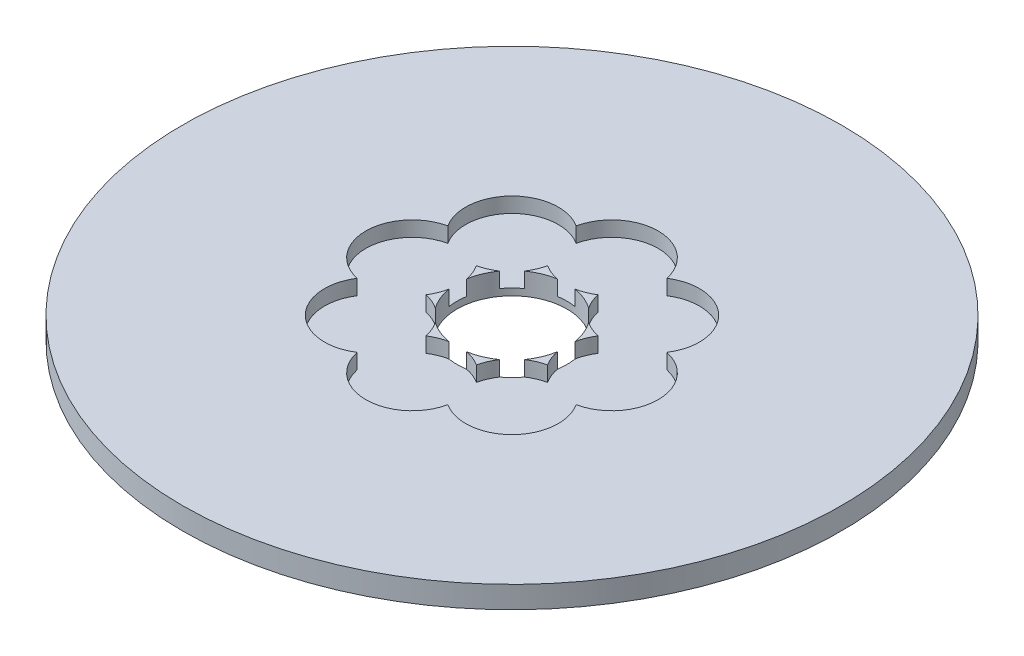
from build123d import *

# Parameters (mm, degrees)
SKETCH1_R           = 60
BOSS_EXTRUDE1_DEPTH = 4
SKETCH2_R           = 10
CUT_EXTRUDE1_DEPTH  = 85.947042326
SKETCH3_R           = 8.446784488
CUT_EXTRUDE2_DEPTH  = 2.755912844
CIRPATTERN1_COUNT   = 8


with BuildPart() as part:
    # Sketch1 → Boss-Extrude1 (new body)
    with BuildSketch(Plane(origin=(0, 0, 0), x_dir=(1, 0, 0), z_dir=(0, 1, 0))):
        Circle(SKETCH1_R)
    extrude(amount=BOSS_EXTRUDE1_DEPTH)

    # Sketch2 → Cut-Extrude1 (cut, through all)
    with BuildSketch(Plane(origin=(0, 0, 0), x_dir=(1, 0, 0), z_dir=(0, 1, 0))):
        Circle(SKETCH2_R)
    extrude(amount=CUT_EXTRUDE1_DEPTH, mode=Mode.SUBTRACT)

    # Sketch3 → Cut-Extrude2 (cut)
    with BuildSketch(Plane(origin=(0, 4, 0), x_dir=(1, 0, 0), z_dir=(0, 1, 0))):
        with Locations((-18.16438515, 0)):
            Circle(SKETCH3_R)
    cut_extrude2 = extrude(amount=-CUT_EXTRUDE2_DEPTH, mode=Mode.SUBTRACT)

    # CirPattern1: Cut-Extrude2 ×8 about axis
    cirpattern1_axis = Axis((0, 0, 0), (0, 1, 0))
    for i in range(1, CIRPATTERN1_COUNT):
        add(cut_extrude2.rotate(cirpattern1_axis, i * 360 / CIRPATTERN1_COUNT), mode=Mode.SUBTRACT)


solid = part.part
